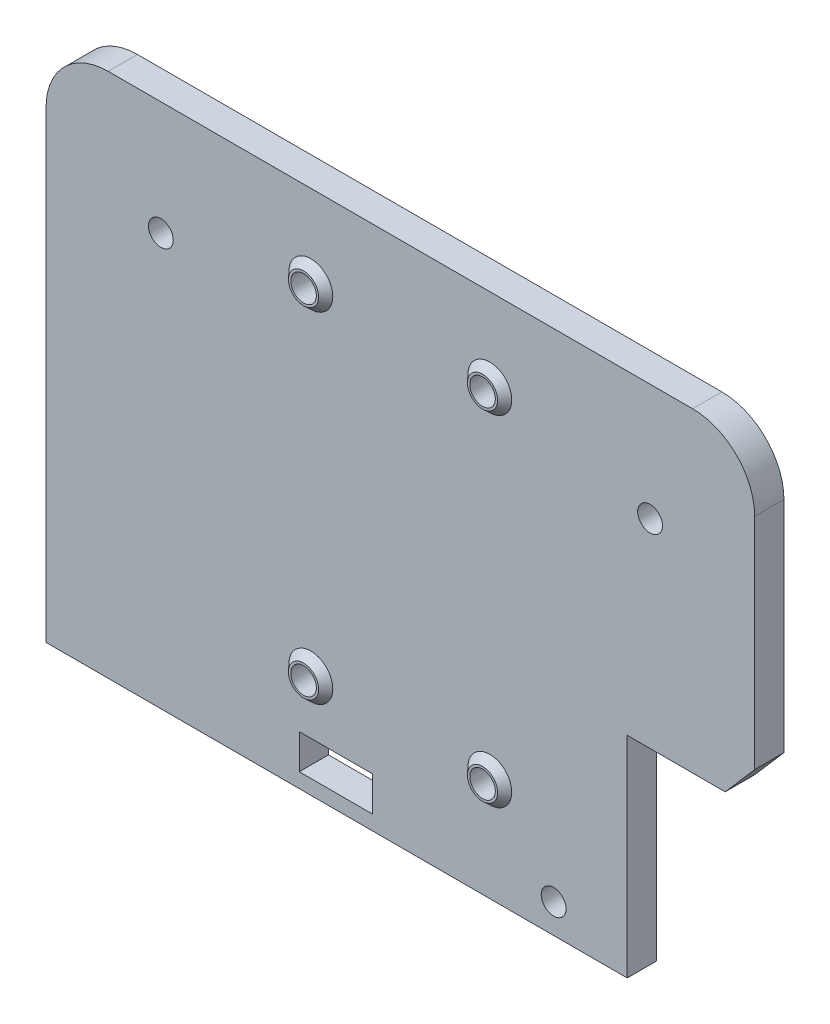
from build123d import *
from OCP.BRepFilletAPI import BRepFilletAPI_MakeChamfer

# Parameters (mm, degrees)
CROQUIS1_R              = 1.7
CROQUIS1_W              = 10.058265445
CROQUIS1_H              = 4.759112173
SALIENTE_EXTRUIR1_DEPTH = 4
CROQUIS2_R              = 3
CROQUIS2_R_2            = 1.75
SALIENTE_EXTRUIR2_DEPTH = 1
CHAFL_N1_SIZE           = 1
CHAFL_N1_SIZE_2         = 0.932515086
CORTAR_EXTRUIR1_START   = -6
CROQUIS3_R              = 1.75
CORTAR_EXTRUIR1_DEPTH   = 6
CORTAR_EXTRUIR2_DEPTH   = 2
CORTAR_EXTRUIR3_DEPTH   = 0.2
CORTAR_EXTRUIR4_DEPTH   = 0.2


with BuildPart() as part:
    # Croquis1 → Saliente-Extruir1 (new body)
    with BuildSketch(Plane.XY):
        with BuildLine():
            Line((46.761077919, -23.458131852), (56.832754836, -23.458131852))
            Line((56.832754836, -23.458131852), (56.832754836, 5.314653818))
            Line((56.832754836, 5.314653818), (70.245248308, 5.314653818))
            Line((70.245248308, 5.314653818), (74.283027827, 9.974351882))
            Line((74.283027827, 9.974351882), (74.283027827, 40))
            ThreePointArc((74.283027827, 40), (71.793435467, 46.01040764), (65.783027827, 48.5))
            Line((65.783027827, 48.5), (-14.216972173, 48.5))
            ThreePointArc((-14.216972173, 48.5), (-20.227379813, 46.01040764), (-22.716972173, 40))
            Line((-22.716972173, 40), (-22.716972173, -23.458131852))
            Line((-22.716972173, -23.458131852), (46.761077919, -23.458131852))
        make_face()
        with Locations((46.761077919, -19.458131852)):
            Circle(CROQUIS1_R, mode=Mode.SUBTRACT)
        with Locations((-7.00634082, 32.938725209)):
            Circle(CROQUIS1_R, mode=Mode.SUBTRACT)
        with Locations((59.964675143, 32.558212342)):
            Circle(CROQUIS1_R, mode=Mode.SUBTRACT)
        with Locations((16.969290087, -19.074136319)):
            Rectangle(CROQUIS1_W, CROQUIS1_H, mode=Mode.SUBTRACT)
    extrude(amount=SALIENTE_EXTRUIR1_DEPTH)

    # Croquis2 → Saliente-Extruir2 (add)
    # profile 1 of 4: a face of its own
    with BuildSketch(Plane.XY.offset(4)):
        with Locations((13.527577906, 37.15608476)):
            Circle(CROQUIS2_R)
        with Locations((13.527577906, 37.15608476)):
            Circle(CROQUIS2_R_2, mode=Mode.SUBTRACT)
    # profile 2 of 4: a face of its own
    with BuildSketch(Plane.XY.offset(4)):
        with Locations((38.027577906, 37.15608476)):
            Circle(CROQUIS2_R)
        with Locations((38.027577906, 37.15608476)):
            Circle(CROQUIS2_R_2, mode=Mode.SUBTRACT)
    # profile 3 of 4: a face of its own
    with BuildSketch(Plane.XY.offset(4)):
        with Locations((38.027577906, -9.34391524)):
            Circle(CROQUIS2_R)
        with Locations((38.027577906, -9.34391524)):
            Circle(CROQUIS2_R_2, mode=Mode.SUBTRACT)
    # profile 4 of 4: a face of its own
    with BuildSketch(Plane.XY.offset(4)):
        with Locations((13.527577906, -9.34391524)):
            Circle(CROQUIS2_R)
        with Locations((13.527577906, -9.34391524)):
            Circle(CROQUIS2_R_2, mode=Mode.SUBTRACT)
    extrude(amount=SALIENTE_EXTRUIR2_DEPTH)

    # Chaflán1
    chafl_n1_edges_1 = [part.edges().sort_by_distance(p)[0] for p in [
        (10.527577906, 37.15608476, 5),
    ]]
    chafl_n1_side_1 = [part.faces().sort_by_distance(p)[0] for p in [
        (10.527577906, 37.15608476, 4.981349698),
    ]]
    chafl_n1_edges_2 = [part.edges().sort_by_distance(p)[0] for p in [
        (35.027577906, 37.15608476, 5),
    ]]
    chafl_n1_side_2 = [part.faces().sort_by_distance(p)[0] for p in [
        (35.027577906, 37.15608476, 4.981349698),
    ]]
    chafl_n1_edges_3 = [part.edges().sort_by_distance(p)[0] for p in [
        (35.027577906, -9.34391524, 5),
    ]]
    chafl_n1_side_3 = [part.faces().sort_by_distance(p)[0] for p in [
        (35.027577906, -9.34391524, 4.981349698),
    ]]
    chafl_n1_edges_4 = [part.edges().sort_by_distance(p)[0] for p in [
        (10.527577906, -9.34391524, 5),
    ]]
    chafl_n1_side_4 = [part.faces().sort_by_distance(p)[0] for p in [
        (10.527577906, -9.34391524, 4.981349698),
    ]]
    chafl_n1 = BRepFilletAPI_MakeChamfer(part.part.solid().wrapped)
    for e in chafl_n1_edges_1:
        chafl_n1.Add(CHAFL_N1_SIZE - 0.0001, CHAFL_N1_SIZE_2 - 0.0001, e.wrapped, chafl_n1_side_1[0].wrapped)
    for e in chafl_n1_edges_2:
        chafl_n1.Add(CHAFL_N1_SIZE - 0.0001, CHAFL_N1_SIZE_2 - 0.0001, e.wrapped, chafl_n1_side_2[0].wrapped)
    for e in chafl_n1_edges_3:
        chafl_n1.Add(CHAFL_N1_SIZE - 0.0001, CHAFL_N1_SIZE_2 - 0.0001, e.wrapped, chafl_n1_side_3[0].wrapped)
    for e in chafl_n1_edges_4:
        chafl_n1.Add(CHAFL_N1_SIZE - 0.0001, CHAFL_N1_SIZE_2 - 0.0001, e.wrapped, chafl_n1_side_4[0].wrapped)
    add(Compound.cast(chafl_n1.Shape()), mode=Mode.REPLACE)  # a hair under: the kernel refuses the full size

    # Croquis3 → Cortar-Extruir1 (cut)
    with BuildSketch(Plane.XY.offset(4).offset(CORTAR_EXTRUIR1_START)):
        with Locations((13.527577906, -9.34391524)):
            Circle(CROQUIS3_R)
        with Locations((38.027577906, -9.34391524)):
            Circle(CROQUIS3_R)
        with Locations((38.027577906, 37.15608476)):
            Circle(CROQUIS3_R)
        with Locations((13.527577906, 37.15608476)):
            Circle(CROQUIS3_R)
    extrude(amount=CORTAR_EXTRUIR1_DEPTH, mode=Mode.SUBTRACT)

    # Croquis5 → Cortar-Extruir2 (cut)
    with BuildSketch(Plane(origin=(0, 0, 0), x_dir=(-1, 0, 0), z_dir=(0, 0, -1))):
        Polygon((-13.528313647, -12.655938197), (-10.653313647, -10.996056173), (-10.653313647, -7.676292125), (-13.528313647, -6.016410101), (-16.403313647, -7.676292125), (-16.403313647, -10.996056173), align=None)
        Polygon((-40.868755289, -7.676292125), (-37.993755289, -6.016410101), (-35.118755289, -7.676292125), (-35.118755289, -10.996056173), (-37.993755289, -12.655938197), (-40.868755289, -10.996056173), align=None)
        Polygon((-40.868755289, 38.845431555), (-40.868755289, 35.525667507), (-37.993755289, 33.865785483), (-35.118755289, 35.525667507), (-35.118755289, 38.845431555), (-37.993755289, 40.505313579), align=None)
        Polygon((-16.403313647, 35.525667507), (-16.403313647, 38.845431555), (-13.528313647, 40.505313579), (-10.653313647, 38.845431555), (-10.653313647, 35.525667507), (-13.528313647, 33.865785483), align=None)
    extrude(amount=-CORTAR_EXTRUIR2_DEPTH, mode=Mode.SUBTRACT)

    # Croquis6 → Cortar-Extruir3 (cut)
    with BuildSketch(Plane(origin=(0, 0, 2), x_dir=(-1, 0, 0), z_dir=(0, 0, -1))):
        with BuildLine():
            Line((-14.680313514, -10.660615896), (-13.528313647, -12.655938197))
            Line((-13.528313647, -12.655938197), (-10.653313647, -10.996056173))
            Line((-10.653313647, -10.996056173), (-11.814996998, -8.983961587))
            ThreePointArc((-11.814996998, -8.983961587), (-11.786957817, -9.162968548), (-11.777577906, -9.34391524))
            ThreePointArc((-11.777577906, -9.34391524), (-12.804662736, -10.937619622), (-14.680313514, -10.660615896))
        make_face()
        with BuildLine():
            Line((-16.403313647, -7.676292125), (-15.244241928, -9.683863233))
            ThreePointArc((-15.244241928, -9.683863233), (-14.393721726, -7.823292051), (-12.359558444, -8.040753494))
            Line((-12.359558444, -8.040753494), (-13.528313647, -6.016410101))
            Line((-13.528313647, -6.016410101), (-16.403313647, -7.676292125))
        make_face()
        Polygon((-38.026842165, 33.828579621), (-40.901842165, 38.808225692), (-38.026842165, 40.468107716), (-35.151842165, 35.488461645), align=None)
        Polygon((-13.528313647, 40.468107716), (-10.653313647, 38.808225692), (-13.528313647, 33.828579621), (-16.403313647, 35.488461645), align=None)
        Polygon((-38.026842165, -12.655938197), (-40.901842165, -10.996056173), (-38.026842165, -6.016410101), (-35.151842165, -7.676292125), align=None)
    extrude(amount=-CORTAR_EXTRUIR3_DEPTH, mode=Mode.SUBTRACT)

    # Croquis7 → Cortar-Extruir4 (cut)
    with BuildSketch(Plane(origin=(0, 0, 2.2), x_dir=(-1, 0, 0), z_dir=(0, 0, -1))):
        with BuildLine():
            ThreePointArc((-15.244241928, -9.683863233), (-15.11916685, -8.616354498), (-14.393721726, -7.823292051))
            Line((-14.393721726, -7.823292051), (-15.842124921, -8.648299511))
            Line((-15.842124921, -8.648299511), (-15.244241928, -9.683863233))
        make_face()
        with BuildLine():
            Line((-12.962262832, -6.996838873), (-14.393721726, -7.823292051))
            ThreePointArc((-14.393721726, -7.823292051), (-13.341554801, -7.603830356), (-12.359558444, -8.040753494))
            Line((-12.359558444, -8.040753494), (-12.962262832, -6.996838873))
        make_face()
        with BuildLine():
            ThreePointArc((-11.814996998, -8.983961587), (-11.927608639, -10.052856947), (-12.643751504, -10.854329386))
            Line((-12.643751504, -10.854329386), (-11.21229261, -10.027876208))
            Line((-11.21229261, -10.027876208), (-11.814996998, -8.983961587))
        make_face()
        with BuildLine():
            Line((-14.082430521, -11.696179618), (-12.643751504, -10.854329386))
            ThreePointArc((-12.643751504, -10.854329386), (-13.693286293, -11.086052069), (-14.680313514, -10.660615896))
            Line((-14.680313514, -10.660615896), (-14.082430521, -11.696179618))
        make_face()
        with BuildLine():
            ThreePointArc((-39.195597368, -8.040753494), (-38.213601012, -7.603830356), (-37.161434087, -7.823292051))
            Line((-37.161434087, -7.823292051), (-38.592892981, -6.996838873))
            Line((-38.592892981, -6.996838873), (-39.195597368, -8.040753494))
        make_face()
        with BuildLine():
            Line((-36.310913885, -9.683863233), (-35.713030891, -8.648299511))
            Line((-35.713030891, -8.648299511), (-37.161434087, -7.823292051))
            ThreePointArc((-37.161434087, -7.823292051), (-36.435988962, -8.616354498), (-36.310913885, -9.683863233))
        make_face()
        with BuildLine():
            Line((-37.472725291, -11.696179618), (-36.874842298, -10.660615896))
            ThreePointArc((-36.874842298, -10.660615896), (-37.86186952, -11.086052069), (-38.911404308, -10.854329386))
            Line((-38.911404308, -10.854329386), (-37.472725291, -11.696179618))
        make_face()
        with BuildLine():
            Line((-40.342863202, -10.027876208), (-38.911404308, -10.854329386))
            ThreePointArc((-38.911404308, -10.854329386), (-39.627547173, -10.052856947), (-39.740158814, -8.983961587))
            Line((-39.740158814, -8.983961587), (-40.342863202, -10.027876208))
        make_face()
        with BuildLine():
            ThreePointArc((-39.740158814, 36.796131106), (-39.627547173, 37.865026467), (-38.911404308, 38.666498906))
            Line((-38.911404308, 38.666498906), (-40.342863202, 37.840045728))
            Line((-40.342863202, 37.840045728), (-39.740158814, 36.796131106))
        make_face()
        with BuildLine():
            ThreePointArc((-38.911404308, 38.666498906), (-37.86186952, 38.898221589), (-36.874842298, 38.472785416))
            Line((-36.874842298, 38.472785416), (-37.472725291, 39.508349137))
            Line((-37.472725291, 39.508349137), (-38.911404308, 38.666498906))
        make_face()
        with BuildLine():
            ThreePointArc((-36.310913885, 37.496032752), (-36.435988962, 36.428524018), (-37.161434087, 35.635461571))
            Line((-37.161434087, 35.635461571), (-35.713030891, 36.460469031))
            Line((-35.713030891, 36.460469031), (-36.310913885, 37.496032752))
        make_face()
        with BuildLine():
            ThreePointArc((-37.161434087, 35.635461571), (-38.213601012, 35.415999876), (-39.195597368, 35.852923014))
            Line((-39.195597368, 35.852923014), (-38.592892981, 34.809008393))
            Line((-38.592892981, 34.809008393), (-37.161434087, 35.635461571))
        make_face()
        with BuildLine():
            Line((-11.814996998, 36.796131106), (-11.21229261, 37.840045728))
            Line((-11.21229261, 37.840045728), (-12.643751504, 38.666498906))
            ThreePointArc((-12.643751504, 38.666498906), (-11.927608639, 37.865026467), (-11.814996998, 36.796131106))
        make_face()
        with BuildLine():
            ThreePointArc((-14.680313514, 38.472785416), (-13.693286293, 38.898221589), (-12.643751504, 38.666498906))
            Line((-12.643751504, 38.666498906), (-14.082430521, 39.508349137))
            Line((-14.082430521, 39.508349137), (-14.680313514, 38.472785416))
        make_face()
        with BuildLine():
            Line((-15.842124921, 36.460469031), (-14.393721726, 35.635461571))
            ThreePointArc((-14.393721726, 35.635461571), (-15.11916685, 36.428524018), (-15.244241928, 37.496032752))
            Line((-15.244241928, 37.496032752), (-15.842124921, 36.460469031))
        make_face()
        with BuildLine():
            Line((-12.962262832, 34.809008393), (-12.359558444, 35.852923014))
            ThreePointArc((-12.359558444, 35.852923014), (-13.341554801, 35.415999876), (-14.393721726, 35.635461571))
            Line((-14.393721726, 35.635461571), (-12.962262832, 34.809008393))
        make_face()
    extrude(amount=-CORTAR_EXTRUIR4_DEPTH, mode=Mode.SUBTRACT)


solid = part.part
